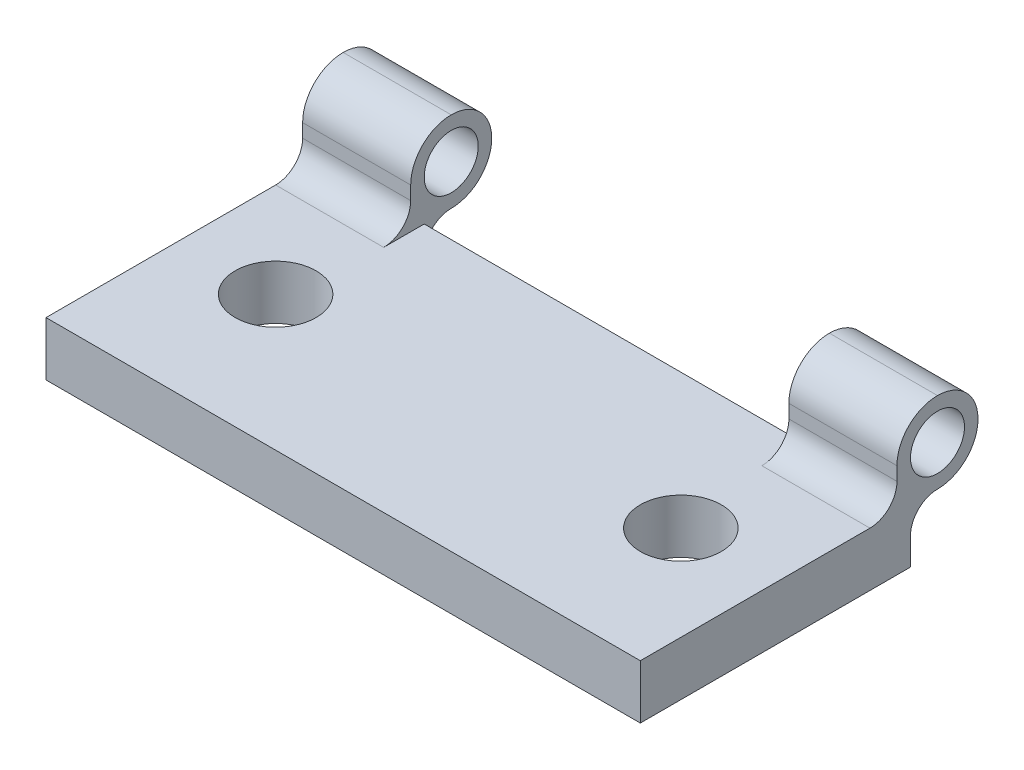
from build123d import *

# Parameters (mm, degrees)
SKETCH2_W           = 22
SKETCH2_H           = 10
SKETCH2_R           = 1.5
BOSS_EXTRUDE1_DEPTH = 2
SKETCH3_W           = 3
SKETCH3_H           = 3
SKETCH3_R           = 1
BOSS_EXTRUDE2_DEPTH = 4
FILLET1_R           = 1.5
FILLET2_R           = 1
FILLET3_R           = 1
FILLET4_R           = 1.5


with BuildPart() as part:
    # Sketch2 → Boss-Extrude1 (new body)
    with BuildSketch(Plane(origin=(0, 0, 0), x_dir=(1, 0, 0), z_dir=(0, 1, 0))):
        Rectangle(SKETCH2_W, SKETCH2_H)
        with Locations(Location((-7.5, 0, 0), (0, 0, 270))):
            Circle(SKETCH2_R, mode=Mode.SUBTRACT)
        with Locations(Location((7.5, 0, 0), (0, 0, 270))):
            Circle(SKETCH2_R, mode=Mode.SUBTRACT)
    extrude(amount=BOSS_EXTRUDE1_DEPTH)

    # Sketch3 → Boss-Extrude2 (add)
    with BuildSketch(Plane(origin=(11, 0, 0), x_dir=(0, 0, -1), z_dir=(1, 0, 0))):
        with Locations((6, 3.5)):
            Rectangle(SKETCH3_W, SKETCH3_H)
        with Locations((6, 3.5)):
            Circle(SKETCH3_R, mode=Mode.SUBTRACT)
    boss_extrude2 = extrude(amount=-BOSS_EXTRUDE2_DEPTH)

    # Mirror1: Boss-Extrude2 across plane
    add(boss_extrude2.mirror(Plane(origin=(0, 0, 0), x_dir=(0, 0, 1), z_dir=(1, 0, 0))))

    # Fillet1
    fillet1_edges = [part.edges().sort_by_distance(p)[0] for p in [
        (9, 5, -7.5),
        (9, 5, -4.5),
        (-9, 5, -7.5),
        (-9, 5, -4.5),
    ]]
    fillet(fillet1_edges, radius=FILLET1_R - 0.0001)  # a hair under: the kernel refuses the full size

    # Fillet2
    fillet2_edges = [part.edges().sort_by_distance(p)[0] for p in [
        (9, 2, -4.5),
        (-9, 2, -4.5),
    ]]
    fillet(fillet2_edges, radius=FILLET2_R)

    # Fillet3
    fillet3_edges = [part.edges().sort_by_distance(p)[0] for p in [
        (-9, 2, -5),
        (9, 2, -5),
    ]]
    fillet(fillet3_edges, radius=FILLET3_R)

    # Fillet4
    fillet4_edges = [part.edges().sort_by_distance(p)[0] for p in [
        (-9, 2, -7.5),
        (9, 2, -7.5),
    ]]
    fillet(fillet4_edges, radius=FILLET4_R - 0.0001)  # a hair under: the kernel refuses the full size


solid = part.part
